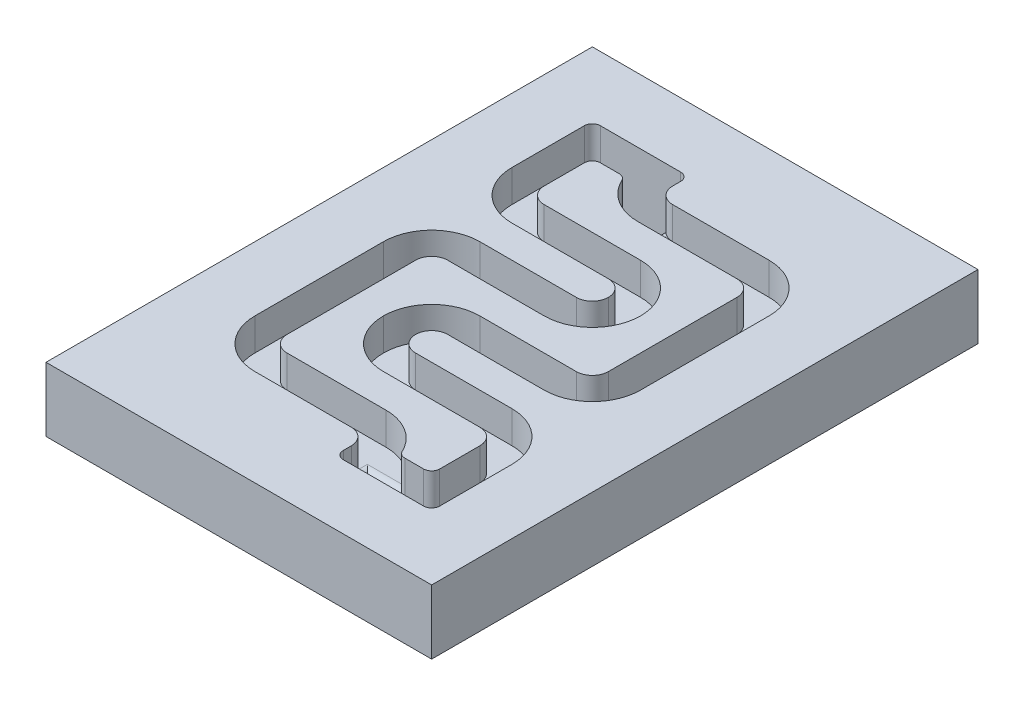
from build123d import *

# Parameters (mm, degrees)
SKIZZE1_W                            = 12
SKIZZE1_H                            = 17
AUFSATZ_LINEAR_AUSTRAGEN1_DEPTH      = 2
SCHNITT_LINEAR_AUSTRAGEN1_DEPTH      = 21.90454496
SCHNITT_LINEAR_AUSTRAGEN1_DEPTH_BACK = 21.90454496
SKIZZE4_W                            = 3
SKIZZE4_H                            = 1
SCHNITT_LINEAR_AUSTRAGEN3_DEPTH      = 1
VERRUNDUNG1_R                        = 0.5
VERRUNDUNG2_R                        = 1.5
VERRUNDUNG3_R                        = 0.25


# Some blends are built 0.0001 mm under size
with BuildPart() as part:
    # Skizze1 → Aufsatz-Linear austragen1 (new body)
    with BuildSketch(Plane(origin=(0, 0, 0), x_dir=(1, 0, 0), z_dir=(0, 1, 0))):
        with Locations((6, 8.5)):
            Rectangle(SKIZZE1_W, SKIZZE1_H)
    extrude(amount=AUFSATZ_LINEAR_AUSTRAGEN1_DEPTH)

    # Skizze4 → Schnitt-Linear austragen1 (cut, two sides: drawn at the far end of the back side and taken through both)
    with BuildSketch(Plane(origin=(0, 2, 0), x_dir=(1, 0, 0), z_dir=(0, 1, 0)).offset(-SCHNITT_LINEAR_AUSTRAGEN1_DEPTH_BACK)):
        with Locations((8.5, 2.5)):
            Rectangle(SKIZZE4_W, SKIZZE4_H)
        with Locations((3.5, 14.5)):
            Rectangle(SKIZZE4_W, SKIZZE4_H)
    extrude(amount=SCHNITT_LINEAR_AUSTRAGEN1_DEPTH + SCHNITT_LINEAR_AUSTRAGEN1_DEPTH_BACK, mode=Mode.SUBTRACT)

    # Skizze3 → Schnitt-Linear austragen3 (cut)
    with BuildSketch(Plane(origin=(0, 2, 0), x_dir=(1, 0, 0), z_dir=(0, 1, 0))):
        Polygon((8, 4), (3, 4), (3, 9), (8, 9), (8, 12), (3, 12), (3, 14), (2, 14), (2, 11), (7, 11), (7, 10), (2, 10), (2, 3), (8, 3), align=None)
        Polygon((9, 5), (4, 5), (4, 8), (9, 8), (9, 13), (4, 13), (4, 14), (10, 14), (10, 7), (5, 7), (5, 6), (10, 6), (10, 3), (9, 3), align=None)
    extrude(amount=-SCHNITT_LINEAR_AUSTRAGEN3_DEPTH, mode=Mode.SUBTRACT)

    # Verrundung1
    verrundung1_edges = [part.edges().sort_by_distance(p)[0] for p in [
        (3, 1.5, -12),
        (3, 1.5, -9),
        (7, 1.5, -3),
        (5, 1.5, -14),
        (9, 1.5, -5),
        (9, 1.5, -8),
        (9, 1.5, -13),
        (5, 1.5, -7),
        (5, 1.5, -6),
        (3, 1.5, -4),
        (7, 1.5, -10),
        (7, 1.5, -11),
    ]]
    fillet(verrundung1_edges, radius=VERRUNDUNG1_R - 0.0001)  # a hair under: the kernel refuses the full size

    # Verrundung2
    # the kernel refuses this fillet: 1.5 mm, written as the material it adds along each edge
    with BuildSketch(Plane(origin=(4, 2, -8), x_dir=(0, 0, 1), z_dir=(0, -1, 0)), Plane(origin=(2, 2, -11), x_dir=(1, 0, 0), z_dir=(0, -1, 0)), Plane(origin=(2, 2, -3), x_dir=(1, 0, 0), z_dir=(0, -1, 0)), Plane(origin=(2, 2, -10), x_dir=(0, 0, 1), z_dir=(0, -1, 0)), Plane(origin=(4, 2, -5), x_dir=(1, 0, 0), z_dir=(0, -1, 0))) as verrundung2_piece_1:
        with BuildLine():
            CenterArc((VERRUNDUNG2_R, -VERRUNDUNG2_R), VERRUNDUNG2_R, 90, 90)
            Line((0, -VERRUNDUNG2_R), (-VERRUNDUNG2_R * 0.02, -VERRUNDUNG2_R))
            Line((-VERRUNDUNG2_R * 0.02, -VERRUNDUNG2_R), (-VERRUNDUNG2_R * 0.02, VERRUNDUNG2_R * 0.02))
            Line((-VERRUNDUNG2_R * 0.02, VERRUNDUNG2_R * 0.02), (VERRUNDUNG2_R, VERRUNDUNG2_R * 0.02))
            Line((VERRUNDUNG2_R, VERRUNDUNG2_R * 0.02), (VERRUNDUNG2_R, 0))
        make_face()
    extrude(amount=1)
    with BuildSketch(Plane(origin=(8, 2, -4), x_dir=(-1, 0, 0), z_dir=(0, -1, 0)), Plane(origin=(4, 2, -13), x_dir=(1, 0, 0), z_dir=(0, -1, 0))) as verrundung2_piece_2:
        with BuildLine():
            CenterArc((1.414213562, -1.5), VERRUNDUNG2_R, 90, 70.528779366)
            Line((0, -1), (-0.028284271, -0.99))
            ThreePointArc((-0.028284271, -0.99), (-0.03, -0.5), (-0.03, 0))
            Line((-0.03, 0), (0, 0.03))
            Line((0, 0.03), (1.414213562, 0.03))
            Line((1.414213562, 0.03), (1.414213562, 0))
        make_face()
    extrude(amount=1)
    with BuildSketch(Plane(origin=(10, 2, -14), x_dir=(0, 0, 1), z_dir=(0, -1, 0)), Plane(origin=(10, 2, -7), x_dir=(-1, 0, 0), z_dir=(0, -1, 0)), Plane(origin=(10, 2, -6), x_dir=(0, 0, 1), z_dir=(0, -1, 0)), Plane(origin=(8, 2, -12), x_dir=(0, 0, 1), z_dir=(0, -1, 0)), Plane(origin=(8, 2, -9), x_dir=(-1, 0, 0), z_dir=(0, -1, 0))) as verrundung2_piece_3:
        with BuildLine():
            CenterArc((VERRUNDUNG2_R, VERRUNDUNG2_R), VERRUNDUNG2_R, 180, 90)
            Line((0, VERRUNDUNG2_R), (-VERRUNDUNG2_R * 0.02, VERRUNDUNG2_R))
            Line((-VERRUNDUNG2_R * 0.02, VERRUNDUNG2_R), (-VERRUNDUNG2_R * 0.02, -VERRUNDUNG2_R * 0.02))
            Line((-VERRUNDUNG2_R * 0.02, -VERRUNDUNG2_R * 0.02), (VERRUNDUNG2_R, -VERRUNDUNG2_R * 0.02))
            Line((VERRUNDUNG2_R, -VERRUNDUNG2_R * 0.02), (VERRUNDUNG2_R, 0))
        make_face()
    extrude(amount=1)

    # Verrundung3
    verrundung3_edges = [part.edges().sort_by_distance(p)[0] for p in [
        (3, 1.5, -14),
        (2.5, 1, -14),
        (5, 1, -14.24995),
        (7, 1, -2.75005),
        (10, 1, -2),
        (7, 1, -2),
        (2, 1, -15),
        (5, 1, -15),
        (4, 1.5, -14),
        (9, 1.5, -3),
        (4.5, 1, -14),
        (9.5, 1, -3),
        (7.5, 1, -3),
        (8, 1.5, -3),
    ]]
    fillet(verrundung3_edges, radius=VERRUNDUNG3_R)


solid = part.part
